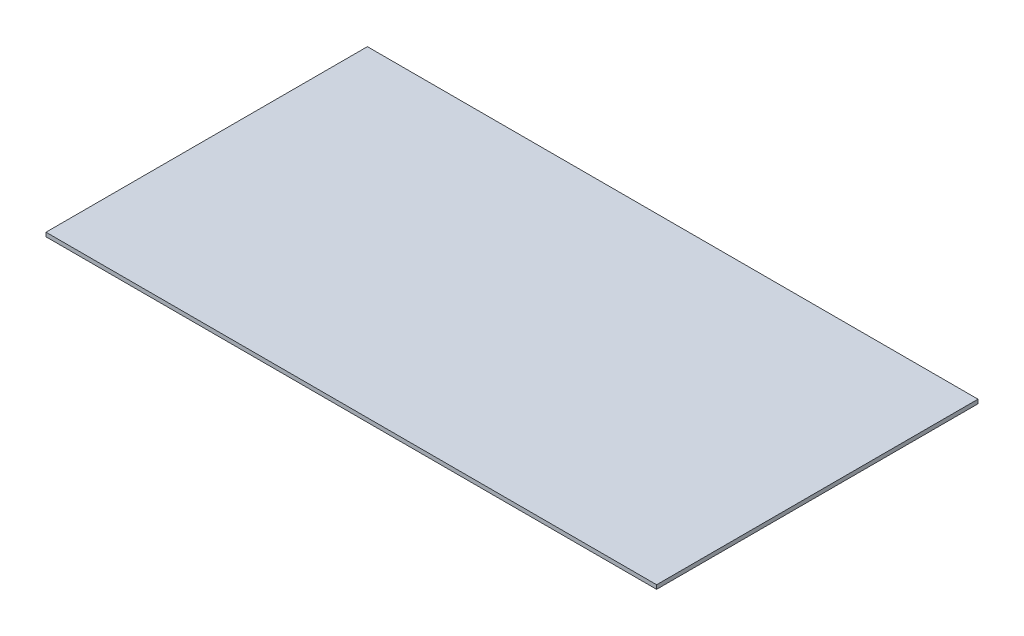
from build123d import *

# Parameters (mm, degrees)
SKETCH1_W           = 482.6
SKETCH1_H           = 254
BOSS_EXTRUDE1_DEPTH = 3.175


with BuildPart() as part:
    # Sketch1 → Boss-Extrude1 (new body)
    with BuildSketch(Plane(origin=(0, 0, 0), x_dir=(1, 0, 0), z_dir=(0, 1, 0))):
        with Locations((241.3, 127)):
            Rectangle(SKETCH1_W, SKETCH1_H)
    extrude(amount=BOSS_EXTRUDE1_DEPTH)


solid = part.part
